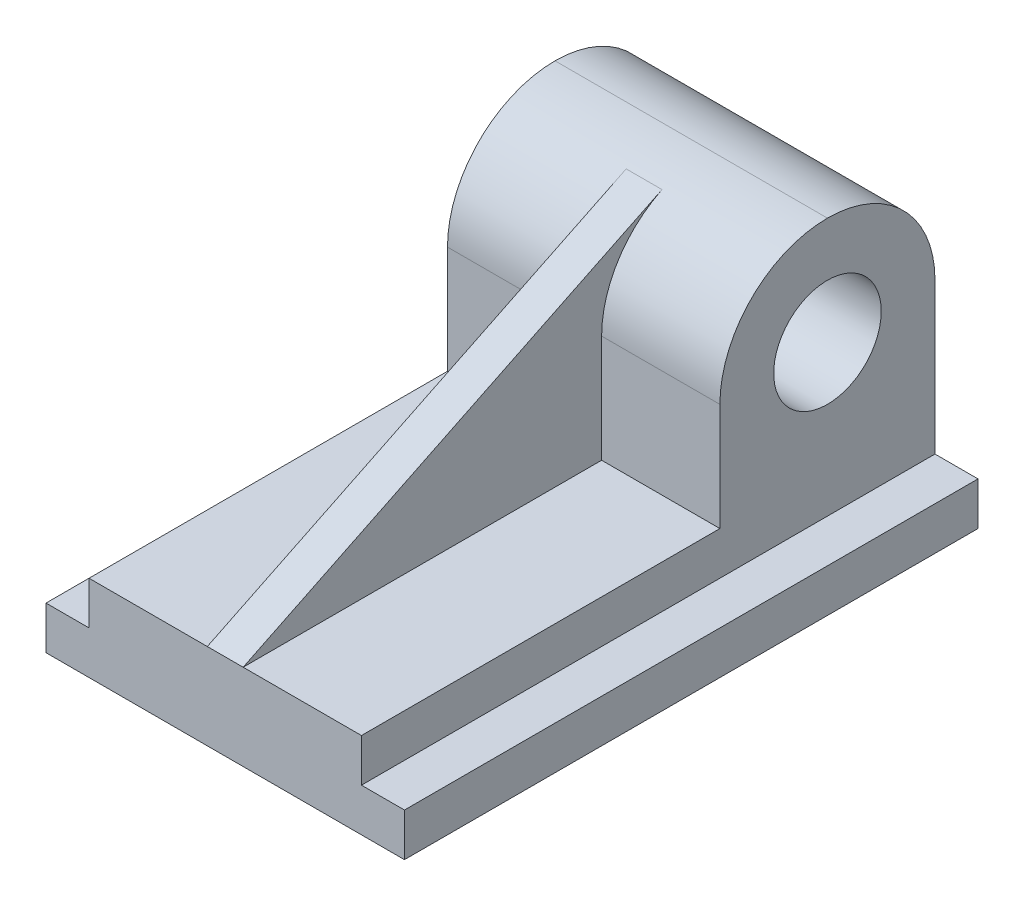
from build123d import *

# Parameters (mm, degrees)
BOSS_EXTRUDE2_DEPTH             = 38
BOSS_EXTRUDE2_DEPTH_BACK        = 38
FILLET1_R                       = 30
CUT_EXTRUDE1_DEPTH              = 111.453610172
CUT_EXTRUDE1_DEPTH_BACK         = 111.453610172
SKETCH3_R                       = 15
BOSS_EXTRUDE3_REACH             = 112.454
SKETCH5_W                       = 100
SKETCH5_H                       = 12
BOSS_EXTRUDE3_DIRECTION_2_REACH = 112.454
RIB1_REACH                      = 117.135
SKETCH7_WALL_W                  = 362.269405062
SKETCH7_WALL_H                  = 10


with BuildPart() as part:
    # Sketch2 → Boss-Extrude2 (new, two sides: drawn at the far end of the back side and taken through both)
    with BuildSketch(Plane(origin=(0, 0, 0), x_dir=(0, 0, -1), z_dir=(1, 0, 0)).offset(-BOSS_EXTRUDE2_DEPTH_BACK)):
        Polygon((-80, 6), (20, 6), (20, 66), (80, 66), (80, 6), (80, -6), (-80, -6), align=None)
    extrude(amount=BOSS_EXTRUDE2_DEPTH + BOSS_EXTRUDE2_DEPTH_BACK)

    # Fillet1
    fillet1_edges = [part.edges().sort_by_distance(p)[0] for p in [
        (0, 66, -80),
        (0, 66, -20),
    ]]
    fillet(fillet1_edges, radius=FILLET1_R - 0.0001)  # a hair under: the kernel refuses the full size

    # Sketch3 → Cut-Extrude1 (cut, two sides: drawn at the far end of the back side and taken through both)
    with BuildSketch(Plane(origin=(0, 0, 0), x_dir=(0, 0, -1), z_dir=(1, 0, 0)).offset(-CUT_EXTRUDE1_DEPTH_BACK)):
        with Locations((50, 36)):
            Circle(SKETCH3_R)
    extrude(amount=CUT_EXTRUDE1_DEPTH + CUT_EXTRUDE1_DEPTH_BACK, mode=Mode.SUBTRACT)

    # Boss-Extrude3: up to this face of the body (flat: up to its plane)
    boss_extrude3_end = Plane(part.part.faces().sort_by_distance((0, 0, 80))[0])
    # Sketch5 → Boss-Extrude3 (add, up to the picked face)
    with BuildSketch(Plane.XY, mode=Mode.PRIVATE) as boss_extrude3_sk1:
        with Locations((0, -12)):
            Rectangle(SKETCH5_W, SKETCH5_H)
    boss_extrude3_tool1 = split(extrude(boss_extrude3_sk1.sketch, amount=BOSS_EXTRUDE3_REACH, mode=Mode.PRIVATE), bisect_by=boss_extrude3_end, keep=Keep.BOTH, mode=Mode.PRIVATE)
    add(boss_extrude3_tool1.solids().sort_by(Axis((0, -12, 0), (0, 0, 1)))[0])

    # Boss-Extrude3 direction 2: up to this face of the body (flat: up to its plane)
    boss_extrude3_direction_2_end = Plane(part.part.faces().sort_by_distance((0, 15.00005, -80))[0])
    # Sketch5 → Boss-Extrude3 direction 2 (add, up to the picked face)
    with BuildSketch(Plane.XY, mode=Mode.PRIVATE) as boss_extrude3_direction_2_sk1:
        with Locations((0, -12)):
            Rectangle(SKETCH5_W, SKETCH5_H)
    boss_extrude3_direction_2_tool1 = split(extrude(boss_extrude3_direction_2_sk1.sketch, amount=-BOSS_EXTRUDE3_DIRECTION_2_REACH, mode=Mode.PRIVATE), bisect_by=boss_extrude3_direction_2_end, keep=Keep.BOTH, mode=Mode.PRIVATE)
    add(boss_extrude3_direction_2_tool1.solids().sort_by(Axis((0, -12, 0), (0, 0, -1)))[0])

    # Sketch7 wall → Rib1 (add, up to next)
    with BuildSketch(Plane(origin=(0, 34.483145548, 21.573034774), x_dir=(0, 0.438202247192, -0.898876404494), z_dir=(0, 0.898876404494, 0.438202247192)), mode=Mode.PRIVATE) as rib1_sk1:
        Rectangle(SKETCH7_WALL_W, SKETCH7_WALL_H)
    rib1_tool1 = extrude(rib1_sk1.sketch, amount=-RIB1_REACH, mode=Mode.PRIVATE) - part.part
    add(rib1_tool1.solids().sort_by_distance((0, 34.483145548, 21.573034774))[0])


solid = part.part
